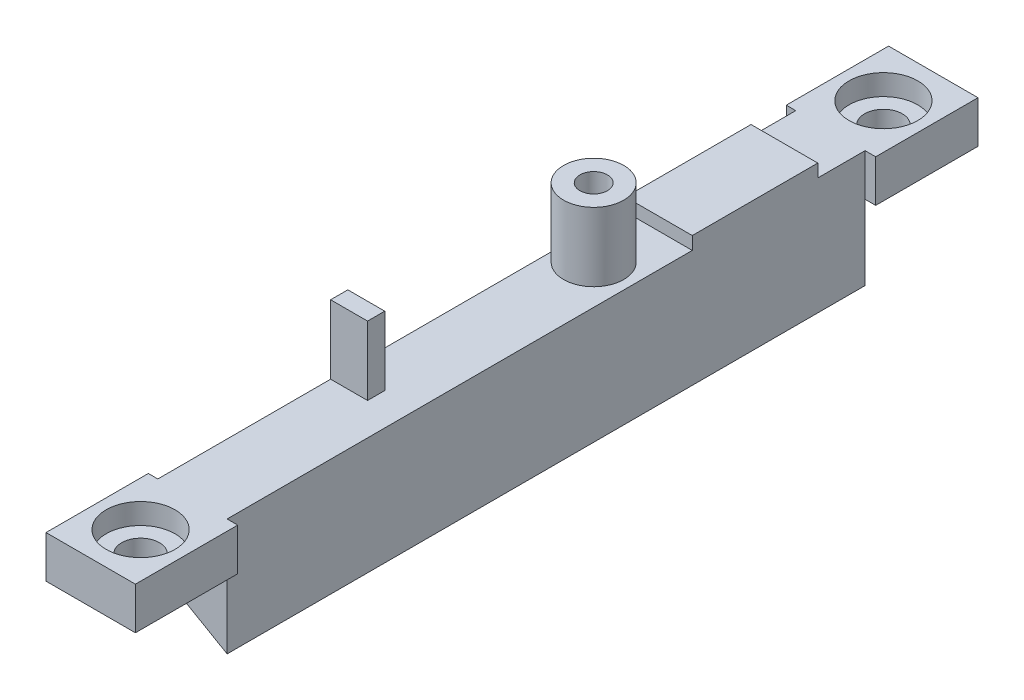
from build123d import *

# Parameters (mm, degrees)
CLAMP_START         = -20.15
CLAMP_X_BASE_DEPTH  = 37.1
EAR_START           = -26.1
SKETCH2_W           = 5.2
SKETCH2_H           = 2.45
EAR_X_BASE_26_DEPTH = 5.95
EAR_START_2         = 16.95
SKETCH3_W           = 5.2
SKETCH3_H           = 2.45
EAR_X_BASE_17_DEPTH = 5.95
CUT_EXTRUDE1_START  = -6.55
SKETCH4_R           = 1.1
CUT_EXTRUDE1_DEPTH  = 2.65
CUT_EXTRUDE2_START  = -5.21
SKETCH5_R           = 2
CUT_EXTRUDE2_DEPTH  = 1.22
BOSS_EXTRUDE4_START = -4
SKETCH6_W           = 3.882851153
SKETCH6_H           = 7.3
BOSS_EXTRUDE4_DEPTH = 0.75
BOSS_EXTRUDE5_START = -4
SKETCH7_W           = 2.147275866
SKETCH7_H           = 1
BOSS_EXTRUDE5_DEPTH = 4
BOSS_EXTRUDE6_START = -4
SKETCH8_R           = 1.75
BOSS_EXTRUDE6_DEPTH = 4
CUT_EXTRUDE3_START  = -5.5
SKETCH9_R           = 0.8
CUT_EXTRUDE3_DEPTH  = 5.6


with BuildPart() as part:
    # Sketch1 → Clamp -X base (new body)
    with BuildSketch(Plane.XY.offset(CLAMP_START)):
        Polygon((-17.397275866, -4), (-13.367148847, -4), (-13.367148847, -10.796897507), (-17.397275866, -8.470102587), align=None)
    extrude(amount=CLAMP_X_BASE_DEPTH)

    # Sketch2 → Ear -X base -26 (add)
    with BuildSketch(Plane.XY.offset(EAR_START)):
        with Locations((-15.35, -5.225)):
            Rectangle(SKETCH2_W, SKETCH2_H)
    extrude(amount=EAR_X_BASE_26_DEPTH)

    # Sketch3 → Ear -X base 17 (add)
    with BuildSketch(Plane.XY.offset(EAR_START_2)):
        with Locations((-15.35, -5.225)):
            Rectangle(SKETCH3_W, SKETCH3_H)
    extrude(amount=EAR_X_BASE_17_DEPTH)

    # Sketch4 → Cut-Extrude1 (cut)
    with BuildSketch(Plane(origin=(0, 0, 0), x_dir=(1, 0, 0), z_dir=(0, 1, 0)).offset(CUT_EXTRUDE1_START)):
        with Locations((-15.35, 23.2)):
            Circle(SKETCH4_R)
        with Locations((-15.35, -20)):
            Circle(SKETCH4_R)
    extrude(amount=CUT_EXTRUDE1_DEPTH, mode=Mode.SUBTRACT)

    # Sketch5 → Cut-Extrude2 (cut)
    with BuildSketch(Plane(origin=(0, 0, 0), x_dir=(1, 0, 0), z_dir=(0, 1, 0)).offset(CUT_EXTRUDE2_START)):
        with Locations((-15.35, 23.2)):
            Circle(SKETCH5_R)
        with Locations((-15.35, -20)):
            Circle(SKETCH5_R)
    extrude(amount=CUT_EXTRUDE2_DEPTH, mode=Mode.SUBTRACT)

    # Sketch6 → Boss-Extrude4 (add)
    with BuildSketch(Plane(origin=(0, 0, 0), x_dir=(1, 0, 0), z_dir=(0, 1, 0)).offset(BOSS_EXTRUDE4_START)):
        with Locations((-15.308574424, 13.75)):
            Rectangle(SKETCH6_W, SKETCH6_H)
    extrude(amount=BOSS_EXTRUDE4_DEPTH)

    # Sketch7 → Boss-Extrude5 (add)
    with BuildSketch(Plane(origin=(0, 0, 0), x_dir=(1, 0, 0), z_dir=(0, 1, 0)).offset(BOSS_EXTRUDE5_START)):
        with Locations((-16.323637933, -6.4)):
            Rectangle(SKETCH7_W, SKETCH7_H)
    extrude(amount=BOSS_EXTRUDE5_DEPTH)

    # Sketch8 → Boss-Extrude6 (add)
    with BuildSketch(Plane(origin=(0, 0, 0), x_dir=(1, 0, 0), z_dir=(0, 1, 0)).offset(BOSS_EXTRUDE6_START)):
        with Locations((-15.64, 6.64)):
            Circle(SKETCH8_R)
    extrude(amount=BOSS_EXTRUDE6_DEPTH)

    # Sketch9 → Cut-Extrude3 (cut)
    with BuildSketch(Plane(origin=(0, 0, 0), x_dir=(1, 0, 0), z_dir=(0, 1, 0)).offset(CUT_EXTRUDE3_START)):
        with Locations((-15.64, 6.64)):
            Circle(SKETCH9_R)
    extrude(amount=CUT_EXTRUDE3_DEPTH, mode=Mode.SUBTRACT)


solid = part.part
